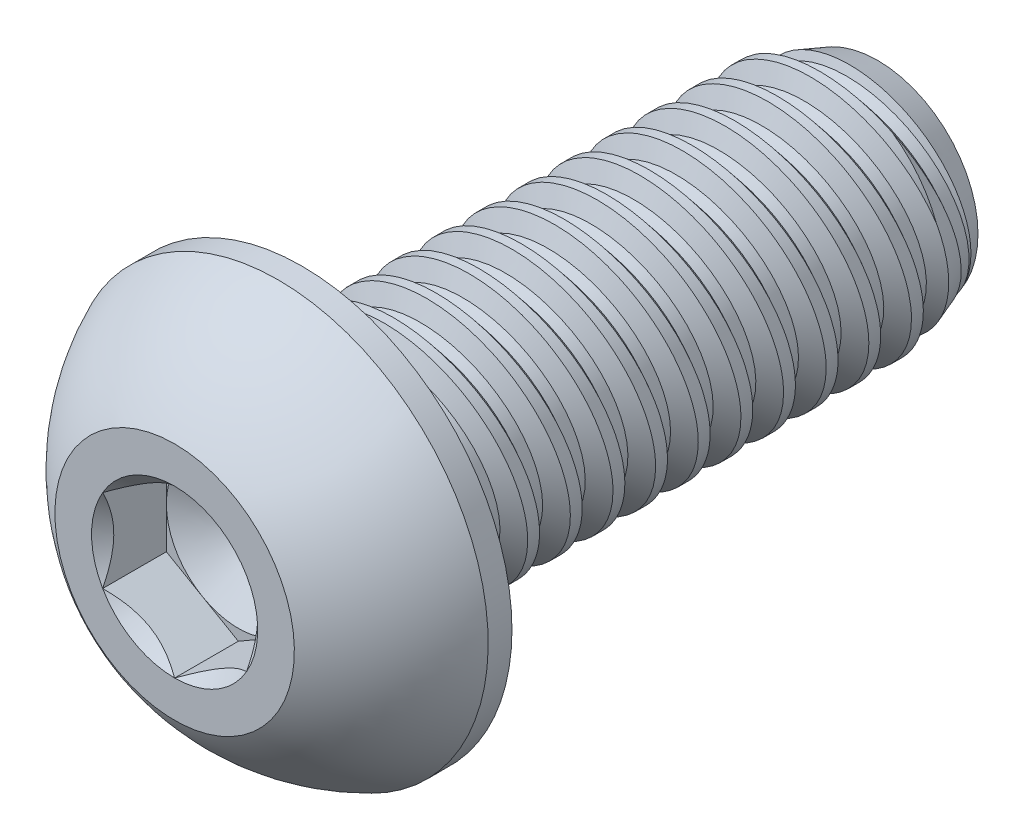
from build123d import *

# Parameters (mm, degrees)
SKETCH1_W          = 19.05
SKETCH1_H          = 3.9624
LPATTERN1_COUNT    = 13
LPATTERN1_PITCH    = 1.411111111
LPATTERN2_COUNT    = 2
LPATTERN2_PITCH    = 1.411111111
SKETCH4_R          = 6.9469
EXTRUDE1_DEPTH     = 4.2164
CUT_EXTRUDE1_DEPTH = 2.1082
SKETCH7_R          = 2.749630657
CUT_EXTRUDE4_DEPTH = 2.1082
CUT_EXTRUDE4_DRAFT = -45
SKETCH8_R          = 2.38125
CUT_EXTRUDE5_DEPTH = 0.702733333
CUT_EXTRUDE5_DRAFT = -60


with BuildPart() as part:
    # Sketch1 → Revolve1 (revolve)
    with BuildSketch(Plane(origin=(0, 0, 0), x_dir=(0, 0, -1), z_dir=(1, 0, 0)), mode=Mode.PRIVATE) as revolve1_sk:
        with Locations((9.525, 1.9812)):
            Rectangle(SKETCH1_W, SKETCH1_H)
    revolve(revolve1_sk.sketch.rotate(Axis((0, 0, 0), (0, 0, 1)), 143.61309377), axis=Axis((0, 0, 0), (0, 0, 1)))

    # Sketch2 → Cut-Revolve1 (revolve, cut)
    with BuildSketch(Plane(origin=(0, 0, 0), x_dir=(0, 0, -1), z_dir=(1, 0, 0)), mode=Mode.PRIVATE) as cut_revolve1_sk:
        Polygon((0.173657354, 3.993321894), (1.389258833, 4.209775148), (1.089011174, 3.380512014), (0.741696466, 3.318668226), align=None)
    cut_revolve1 = revolve(cut_revolve1_sk.sketch.rotate(Axis((0, -0.26919352, 0), (0, 0.17530522317150174, -0.9845141333311523)), 180), axis=Axis((0, -0.26919352, 0), (0, 0.17530522317150174, -0.9845141333311523)), mode=Mode.SUBTRACT)

    # Sketch3 → Cut-Revolve2 (revolve, cut)
    with BuildSketch(Plane(origin=(0, 0, 0), x_dir=(0, 0, -1), z_dir=(1, 0, 0)), mode=Mode.PRIVATE) as cut_revolve2_sk:
        Polygon((19.05, 3.318668226), (17.281361488, 3.9624), (19.05, 3.9624), align=None)
    revolve(cut_revolve2_sk.sketch.rotate(Axis((0, 0, -17.281361488), (0, 0, 1)), 143.61309377), axis=Axis((0, 0, -17.281361488), (0, 0, 1)), mode=Mode.SUBTRACT)

    # LPattern1: Cut-Revolve1 ×13
    with Locations(*[(0, 0, -i * LPATTERN1_PITCH) for i in range(1, LPATTERN1_COUNT)]):
        add(cut_revolve1, mode=Mode.SUBTRACT)

    # LPattern2: Cut-Revolve1 ×2
    with Locations(*[(0, 0, i * LPATTERN2_PITCH) for i in range(1, LPATTERN2_COUNT)]):
        add(cut_revolve1, mode=Mode.SUBTRACT)

    # Sketch4 → Extrude1 (add)
    with BuildSketch(Plane.XY):
        with Locations(Location((0, 0, 0), (0, 0, 90))):
            Circle(SKETCH4_R)
    extrude(amount=EXTRUDE1_DEPTH)

    # Sketch9 → Cut-Revolve3 (revolve, cut)
    with BuildSketch(Plane(origin=(0, 0, 0), x_dir=(0, 0, -1), z_dir=(1, 0, 0))):
        with BuildLine():
            Line((0, 6.9469), (-0.7874, 6.9469))
            ThreePointArc((-0.7874, 6.9469), (-2.730898388, 5.717754531), (-4.2164, 3.9624))
            Line((-4.2164, 3.9624), (-5.0038, 3.9624))
            Line((-5.0038, 3.9624), (-5.0038, 7.7343))
            Line((-5.0038, 7.7343), (0, 7.7343))
            Line((0, 7.7343), (0, 6.9469))
        make_face()
    revolve(axis=Axis((0, 0, 0), (0, 0, 1)), mode=Mode.SUBTRACT)

    # Sketch6 → Cut-Extrude1 (cut)
    with BuildSketch(Plane.XY.offset(4.2164)):
        Polygon((0, -2.749630657), (2.38125, -1.374815329), (2.38125, 1.374815329), (0, 2.749630657), (-2.38125, 1.374815329), (-2.38125, -1.374815329), align=None)
    extrude(amount=-CUT_EXTRUDE1_DEPTH, mode=Mode.SUBTRACT)


with BuildPart() as cut_extrude4_tool:
    # Sketch7 → Cut-Extrude4 (with draft: the straight prism first)
    with BuildSketch(Plane.XY.offset(4.2164)):
        Circle(SKETCH7_R)
    extrude(amount=-CUT_EXTRUDE4_DEPTH)
    # Cut-Extrude4: the draft: its side faces are tilted about the plane it starts from
    cut_extrude4_sides = [cut_extrude4_tool.faces().sort_by_distance(p)[0] for p in [
        (-2.749630657, 0, 3.1623),
    ]]
    draft(cut_extrude4_sides, Plane.XY.offset(4.2164), CUT_EXTRUDE4_DRAFT)


with BuildPart() as part_1:
    add(part.part)

    # Cut-Extrude4: cut by cut_extrude4_tool
    add(cut_extrude4_tool.part, mode=Mode.SUBTRACT)


with BuildPart() as cut_extrude5_tool:
    # Sketch8 → Cut-Extrude5 (with draft: the straight prism first)
    with BuildSketch(Plane.XY.offset(2.1082)):
        Circle(SKETCH8_R)
    extrude(amount=-CUT_EXTRUDE5_DEPTH)
    # Cut-Extrude5: the draft: its side faces are tilted about the plane it starts from
    cut_extrude5_sides = [cut_extrude5_tool.faces().sort_by_distance(p)[0] for p in [
        (-2.38125, 0, 1.756833333),
    ]]
    draft(cut_extrude5_sides, Plane.XY.offset(2.1082), CUT_EXTRUDE5_DRAFT)


with BuildPart() as part_2:
    add(part_1.part)

    # Cut-Extrude5: cut by cut_extrude5_tool
    add(cut_extrude5_tool.part, mode=Mode.SUBTRACT)


solid = part_2.part
